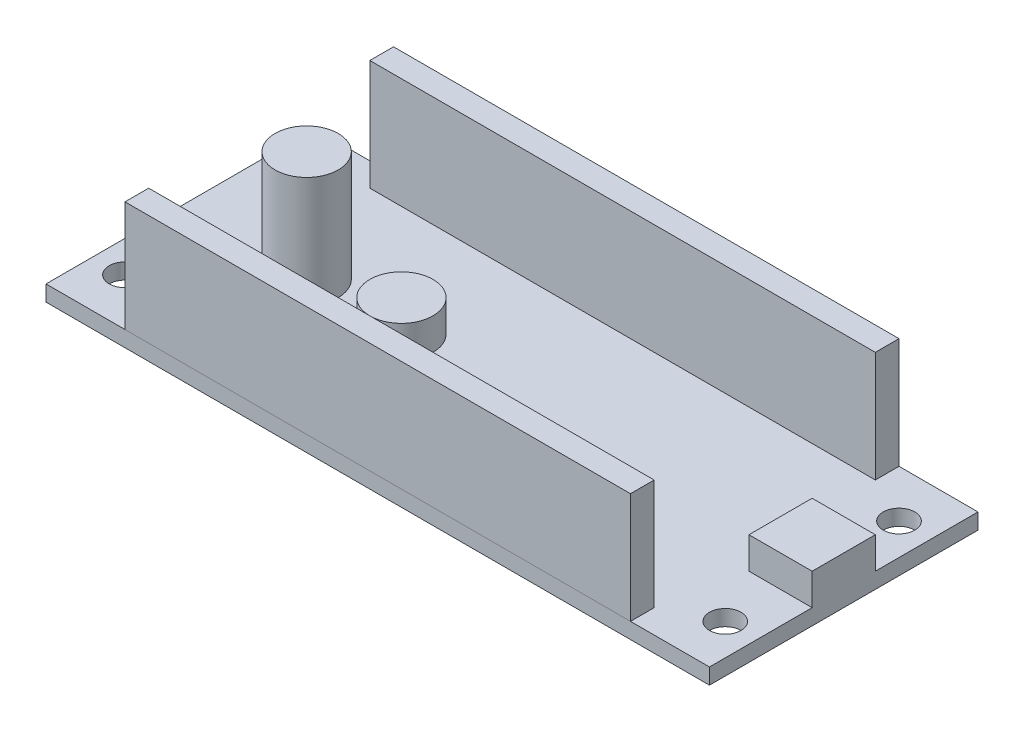
from build123d import *

# Parameters (mm, degrees)
SKETCH1_W             = 66.675
SKETCH1_H             = 26.9875
BOSS_EXTRUDE1_DEPTH   = 1.5875
SKETCH2_R             = 3.175
BOSS_EXTRUDE2_DEPTH   = 11.1125
SKETCH2_W             = 50.8
SKETCH2_H             = 2.38125
BOSS_EXTRUDE2_2_DEPTH = 11.1125
BOSS_EXTRUDE2_3_DEPTH = 11.1125
SKETCH3_R             = 3.175
SKETCH3_W             = 6.35
SKETCH3_H             = 6.35
BOSS_EXTRUDE3_DEPTH   = 3.175
SKETCH4_R             = 1.5875
CUT_EXTRUDE1_DEPTH    = 38.642500602


with BuildPart() as part:
    # Sketch1 → Boss-Extrude1 (new body)
    with BuildSketch(Plane(origin=(0, 0, 0), x_dir=(1, 0, 0), z_dir=(0, 1, 0))):
        Rectangle(SKETCH1_W, SKETCH1_H)
    extrude(amount=BOSS_EXTRUDE1_DEPTH)

    # Sketch3 → Boss-Extrude3 (add)
    with BuildSketch(Plane(origin=(0, 1.5875, 0), x_dir=(1, 0, 0), z_dir=(0, 1, 0))):
        with Locations((-11.1125, 0)):
            Circle(SKETCH3_R)
        with Locations((30.1625, 0)):
            Rectangle(SKETCH3_W, SKETCH3_H)
    extrude(amount=BOSS_EXTRUDE3_DEPTH)

    # Sketch4 → Cut-Extrude1 (cut, through all)
    with BuildSketch(Plane(origin=(0, 1.5875, 0), x_dir=(1, 0, 0), z_dir=(0, 1, 0))):
        with Locations((30.1625, -8.73125)):
            Circle(SKETCH4_R)
        with Locations((30.1625, 8.73125)):
            Circle(SKETCH4_R)
        with Locations((-30.1625, 8.73125)):
            Circle(SKETCH4_R)
        with Locations((-30.1625, -8.73125)):
            Circle(SKETCH4_R)
    extrude(amount=-CUT_EXTRUDE1_DEPTH, mode=Mode.SUBTRACT)


with BuildPart() as body_2:
    # Sketch2 → Boss-Extrude2 (new body)
    with BuildSketch(Plane(origin=(0, 1.5875, 0), x_dir=(1, 0, 0), z_dir=(0, 1, 0))):
        with Locations((-20.6375, 0)):
            Circle(SKETCH2_R)
    extrude(amount=BOSS_EXTRUDE2_DEPTH)


with BuildPart() as body_3:
    # Sketch2 → Boss-Extrude2 2 (new body)
    with BuildSketch(Plane(origin=(0, 1.5875, 0), x_dir=(1, 0, 0), z_dir=(0, 1, 0))):
        with Locations((0, 12.303125)):
            Rectangle(SKETCH2_W, SKETCH2_H)
    extrude(amount=BOSS_EXTRUDE2_2_DEPTH)


with BuildPart() as body_4:
    # Sketch2 → Boss-Extrude2 3 (new body)
    with BuildSketch(Plane(origin=(0, 1.5875, 0), x_dir=(1, 0, 0), z_dir=(0, 1, 0))):
        with Locations((0, -12.303125)):
            Rectangle(SKETCH2_W, SKETCH2_H)
    extrude(amount=BOSS_EXTRUDE2_3_DEPTH)


solid = Compound([part.part, body_2.part, body_3.part, body_4.part])
